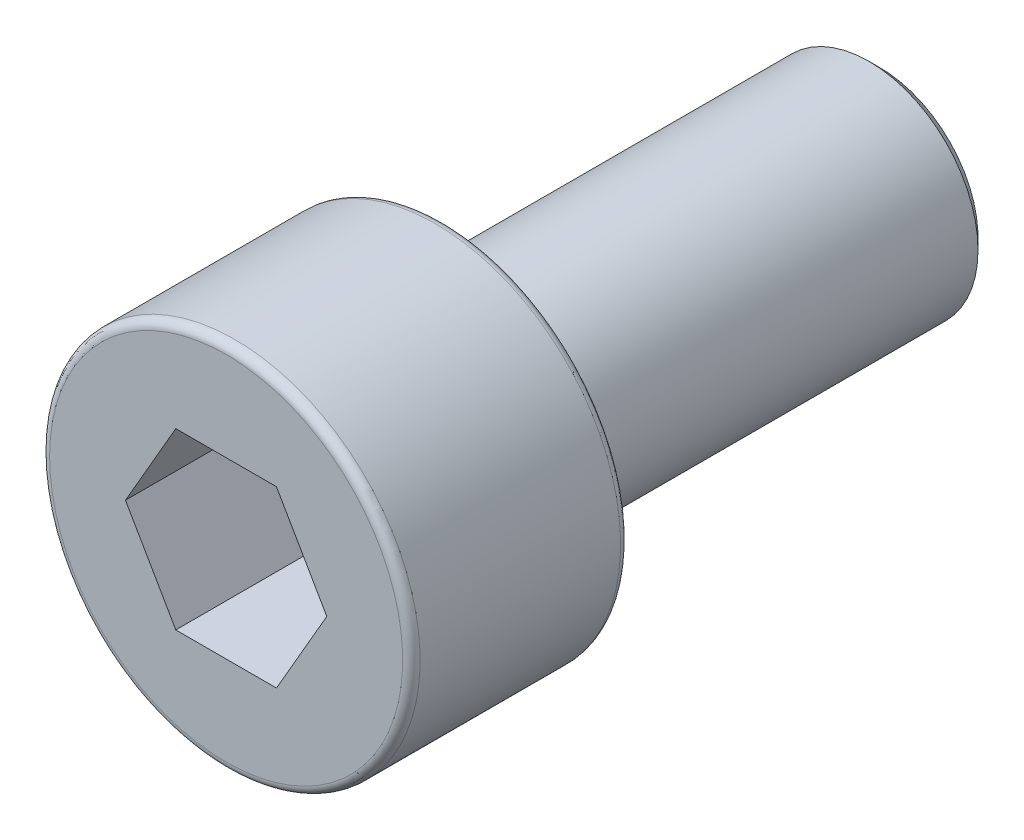
from build123d import *

# Parameters (mm, degrees)
SKETCH1_R           = 4.25
BOSS_EXTRUDE1_DEPTH = 5
SKETCH2_R           = 2.5
BOSS_EXTRUDE2_DEPTH = 10
CUT_EXTRUDE1_DEPTH  = 4
CHAMFER1_SIZE       = 0.25
FILLET1_R           = 0.2


with BuildPart() as part:
    # Sketch1 → Boss-Extrude1 (new body)
    with BuildSketch(Plane.XY.offset(15)):
        Circle(SKETCH1_R)
    extrude(amount=-BOSS_EXTRUDE1_DEPTH)

    # Sketch2 → Boss-Extrude2 (add)
    with BuildSketch(Plane(origin=(0, 0, 10), x_dir=(-1, 0, 0), z_dir=(0, 0, -1))):
        Circle(SKETCH2_R)
    extrude(amount=BOSS_EXTRUDE2_DEPTH)

    # Sketch3 → Cut-Extrude1 (cut)
    with BuildSketch(Plane.XY.offset(15)):
        Polygon((-2.309401077, 0), (-1.154700538, -2), (1.154700538, -2), (2.309401077, 0), (1.154700538, 2), (-1.154700538, 2), align=None)
    extrude(amount=-CUT_EXTRUDE1_DEPTH, mode=Mode.SUBTRACT)

    # Chamfer1
    chamfer1_edges = [part.edges().sort_by_distance(p)[0] for p in [
        (2.5, 0, 0),
    ]]
    chamfer(chamfer1_edges, length=CHAMFER1_SIZE)

    # Fillet1
    fillet1_edges = [part.edges().sort_by_distance(p)[0] for p in [
        (-4.25, 0, 10),
        (-4.25, 0, 15),
    ]]
    fillet(fillet1_edges, radius=FILLET1_R)


solid = part.part
